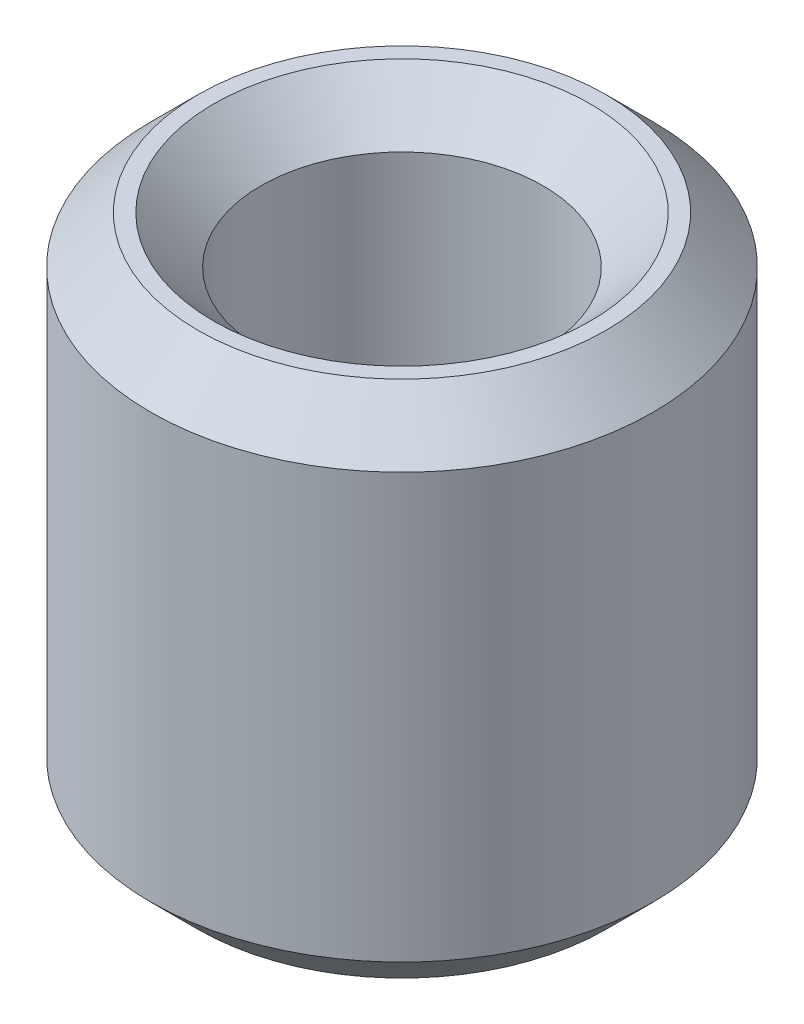
from build123d import *

# Parameters (mm, degrees)
SKETCH1_R           = 17.5
BOSS_EXTRUDE1_DEPTH = 36.116865341
SKETCH2_R           = 9.817018018
CUT_EXTRUDE1_DEPTH  = 44.78273589
CHAMFER1_SIZE       = 3.289797479


with BuildPart() as part:
    # Sketch1 → Boss-Extrude1 (new body)
    with BuildSketch(Plane(origin=(0, 0, 0), x_dir=(1, 0, 0), z_dir=(0, 1, 0))):
        Circle(SKETCH1_R)
    extrude(amount=BOSS_EXTRUDE1_DEPTH)

    # Sketch2 → Cut-Extrude1 (cut, through all)
    with BuildSketch(Plane(origin=(0, 0, 0), x_dir=(1, 0, 0), z_dir=(0, 1, 0))):
        Circle(SKETCH2_R)
    extrude(amount=CUT_EXTRUDE1_DEPTH, mode=Mode.SUBTRACT)

    # Chamfer1
    chamfer1_edges = [part.edges().sort_by_distance(p)[0] for p in [
        (-9.817018018, 36.116865341, 0),
        (-9.817018018, 0, 0),
        (-17.5, 0, 0),
        (-17.5, 36.116865341, 0),
    ]]
    chamfer(chamfer1_edges, length=CHAMFER1_SIZE)


solid = part.part
